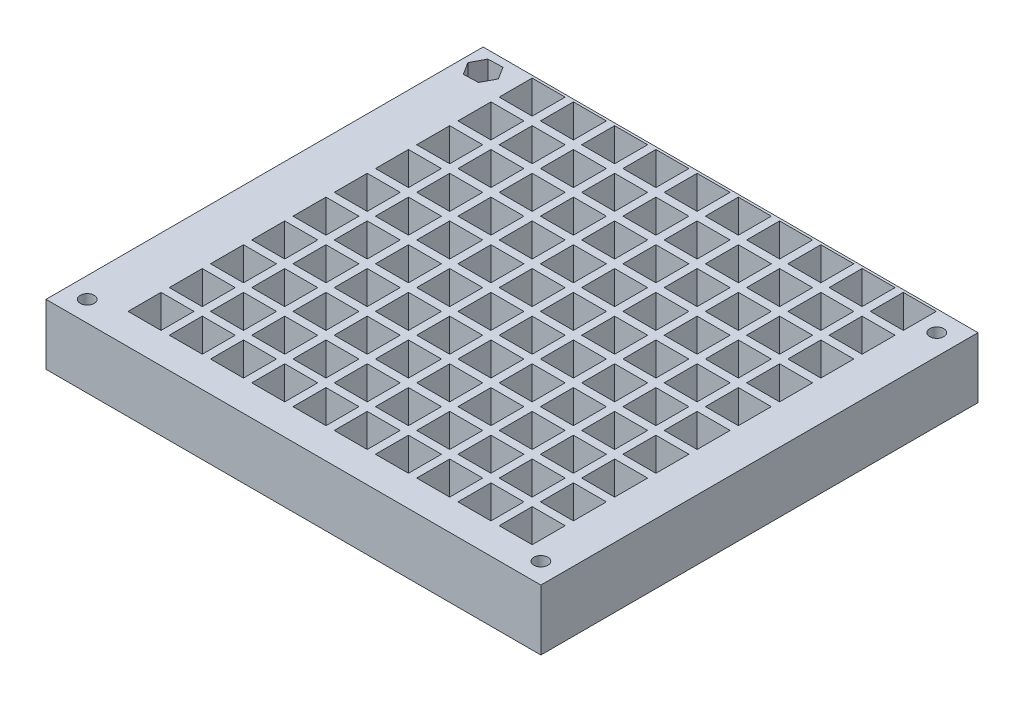
from build123d import *

# Parameters (mm, degrees)
SKETCH1_W           = 120
SKETCH1_H           = 106
SKETCH1_R           = 1.7
SKETCH1_W_2         = 8
SKETCH1_H_2         = 8
BOSS_EXTRUDE1_DEPTH = 14.7


with BuildPart() as part:
    # Sketch1 → Boss-Extrude1 (new body)
    with BuildSketch(Plane(origin=(0, 0, 0), x_dir=(1, 0, 0), z_dir=(0, 1, 0))):
        with Locations((60, 53)):
            Rectangle(SKETCH1_W, SKETCH1_H)
        with Locations((5, 5)):
            Circle(SKETCH1_R, mode=Mode.SUBTRACT)
        with Locations((16.476368188, 11.413812803)):
            Rectangle(SKETCH1_W_2, SKETCH1_H_2, mode=Mode.SUBTRACT)
        with Locations((26.476368188, 11.413812803)):
            Rectangle(SKETCH1_W_2, SKETCH1_H_2, mode=Mode.SUBTRACT)
        with Locations((16.476368188, 21.413812803)):
            Rectangle(SKETCH1_W_2, SKETCH1_H_2, mode=Mode.SUBTRACT)
        with Locations((26.476368188, 21.413812803)):
            Rectangle(SKETCH1_W_2, SKETCH1_H_2, mode=Mode.SUBTRACT)
        with Locations((36.476368188, 11.413812803)):
            Rectangle(SKETCH1_W_2, SKETCH1_H_2, mode=Mode.SUBTRACT)
        with Locations((46.476368188, 11.413812803)):
            Rectangle(SKETCH1_W_2, SKETCH1_H_2, mode=Mode.SUBTRACT)
        with Locations((56.476368188, 11.413812803)):
            Rectangle(SKETCH1_W_2, SKETCH1_H_2, mode=Mode.SUBTRACT)
        with Locations((36.476368188, 21.413812803)):
            Rectangle(SKETCH1_W_2, SKETCH1_H_2, mode=Mode.SUBTRACT)
        with Locations((46.476368188, 21.413812803)):
            Rectangle(SKETCH1_W_2, SKETCH1_H_2, mode=Mode.SUBTRACT)
        with Locations((56.476368188, 21.413812803)):
            Rectangle(SKETCH1_W_2, SKETCH1_H_2, mode=Mode.SUBTRACT)
        with Locations((16.476368188, 31.413812803)):
            Rectangle(SKETCH1_W_2, SKETCH1_H_2, mode=Mode.SUBTRACT)
        with Locations((26.476368188, 31.413812803)):
            Rectangle(SKETCH1_W_2, SKETCH1_H_2, mode=Mode.SUBTRACT)
        with Locations((16.476368188, 41.413812803)):
            Rectangle(SKETCH1_W_2, SKETCH1_H_2, mode=Mode.SUBTRACT)
        with Locations((26.476368188, 41.413812803)):
            Rectangle(SKETCH1_W_2, SKETCH1_H_2, mode=Mode.SUBTRACT)
        with Locations((16.476368188, 51.413812803)):
            Rectangle(SKETCH1_W_2, SKETCH1_H_2, mode=Mode.SUBTRACT)
        with Locations((26.476368188, 51.413812803)):
            Rectangle(SKETCH1_W_2, SKETCH1_H_2, mode=Mode.SUBTRACT)
        with Locations((36.476368188, 31.413812803)):
            Rectangle(SKETCH1_W_2, SKETCH1_H_2, mode=Mode.SUBTRACT)
        with Locations((46.476368188, 31.413812803)):
            Rectangle(SKETCH1_W_2, SKETCH1_H_2, mode=Mode.SUBTRACT)
        with Locations((56.476368188, 31.413812803)):
            Rectangle(SKETCH1_W_2, SKETCH1_H_2, mode=Mode.SUBTRACT)
        with Locations((36.476368188, 41.413812803)):
            Rectangle(SKETCH1_W_2, SKETCH1_H_2, mode=Mode.SUBTRACT)
        with Locations((36.476368188, 51.413812803)):
            Rectangle(SKETCH1_W_2, SKETCH1_H_2, mode=Mode.SUBTRACT)
        with Locations((46.476368188, 41.413812803)):
            Rectangle(SKETCH1_W_2, SKETCH1_H_2, mode=Mode.SUBTRACT)
        with Locations((56.476368188, 41.413812803)):
            Rectangle(SKETCH1_W_2, SKETCH1_H_2, mode=Mode.SUBTRACT)
        with Locations((46.476368188, 51.413812803)):
            Rectangle(SKETCH1_W_2, SKETCH1_H_2, mode=Mode.SUBTRACT)
        with Locations((56.476368188, 51.413812803)):
            Rectangle(SKETCH1_W_2, SKETCH1_H_2, mode=Mode.SUBTRACT)
        with Locations((66.476368188, 11.413812803)):
            Rectangle(SKETCH1_W_2, SKETCH1_H_2, mode=Mode.SUBTRACT)
        with Locations((76.476368188, 11.413812803)):
            Rectangle(SKETCH1_W_2, SKETCH1_H_2, mode=Mode.SUBTRACT)
        with Locations((86.476368188, 11.413812803)):
            Rectangle(SKETCH1_W_2, SKETCH1_H_2, mode=Mode.SUBTRACT)
        with Locations((66.476368188, 21.413812803)):
            Rectangle(SKETCH1_W_2, SKETCH1_H_2, mode=Mode.SUBTRACT)
        with Locations((76.476368188, 21.413812803)):
            Rectangle(SKETCH1_W_2, SKETCH1_H_2, mode=Mode.SUBTRACT)
        with Locations((86.476368188, 21.413812803)):
            Rectangle(SKETCH1_W_2, SKETCH1_H_2, mode=Mode.SUBTRACT)
        with Locations((96.476368188, 11.413812803)):
            Rectangle(SKETCH1_W_2, SKETCH1_H_2, mode=Mode.SUBTRACT)
        with Locations((115, 5)):
            Circle(SKETCH1_R, mode=Mode.SUBTRACT)
        with Locations((106.476368188, 11.413812803)):
            Rectangle(SKETCH1_W_2, SKETCH1_H_2, mode=Mode.SUBTRACT)
        with Locations((96.476368188, 21.413812803)):
            Rectangle(SKETCH1_W_2, SKETCH1_H_2, mode=Mode.SUBTRACT)
        with Locations((106.476368188, 21.413812803)):
            Rectangle(SKETCH1_W_2, SKETCH1_H_2, mode=Mode.SUBTRACT)
        with Locations((66.476368188, 31.413812803)):
            Rectangle(SKETCH1_W_2, SKETCH1_H_2, mode=Mode.SUBTRACT)
        with Locations((76.476368188, 31.413812803)):
            Rectangle(SKETCH1_W_2, SKETCH1_H_2, mode=Mode.SUBTRACT)
        with Locations((86.476368188, 31.413812803)):
            Rectangle(SKETCH1_W_2, SKETCH1_H_2, mode=Mode.SUBTRACT)
        with Locations((66.476368188, 41.413812803)):
            Rectangle(SKETCH1_W_2, SKETCH1_H_2, mode=Mode.SUBTRACT)
        with Locations((66.476368188, 51.413812803)):
            Rectangle(SKETCH1_W_2, SKETCH1_H_2, mode=Mode.SUBTRACT)
        with Locations((76.476368188, 41.413812803)):
            Rectangle(SKETCH1_W_2, SKETCH1_H_2, mode=Mode.SUBTRACT)
        with Locations((86.476368188, 41.413812803)):
            Rectangle(SKETCH1_W_2, SKETCH1_H_2, mode=Mode.SUBTRACT)
        with Locations((76.476368188, 51.413812803)):
            Rectangle(SKETCH1_W_2, SKETCH1_H_2, mode=Mode.SUBTRACT)
        with Locations((86.476368188, 51.413812803)):
            Rectangle(SKETCH1_W_2, SKETCH1_H_2, mode=Mode.SUBTRACT)
        with Locations((96.476368188, 31.413812803)):
            Rectangle(SKETCH1_W_2, SKETCH1_H_2, mode=Mode.SUBTRACT)
        with Locations((106.476368188, 31.413812803)):
            Rectangle(SKETCH1_W_2, SKETCH1_H_2, mode=Mode.SUBTRACT)
        with Locations((96.476368188, 41.413812803)):
            Rectangle(SKETCH1_W_2, SKETCH1_H_2, mode=Mode.SUBTRACT)
        with Locations((96.476368188, 51.413812803)):
            Rectangle(SKETCH1_W_2, SKETCH1_H_2, mode=Mode.SUBTRACT)
        with Locations((106.476368188, 41.413812803)):
            Rectangle(SKETCH1_W_2, SKETCH1_H_2, mode=Mode.SUBTRACT)
        with Locations((106.476368188, 51.413812803)):
            Rectangle(SKETCH1_W_2, SKETCH1_H_2, mode=Mode.SUBTRACT)
        with Locations((16.476368188, 61.413812803)):
            Rectangle(SKETCH1_W_2, SKETCH1_H_2, mode=Mode.SUBTRACT)
        with Locations((26.476368188, 61.413812803)):
            Rectangle(SKETCH1_W_2, SKETCH1_H_2, mode=Mode.SUBTRACT)
        with Locations((16.476368188, 71.413812803)):
            Rectangle(SKETCH1_W_2, SKETCH1_H_2, mode=Mode.SUBTRACT)
        with Locations((26.476368188, 71.413812803)):
            Rectangle(SKETCH1_W_2, SKETCH1_H_2, mode=Mode.SUBTRACT)
        with Locations((36.476368188, 61.413812803)):
            Rectangle(SKETCH1_W_2, SKETCH1_H_2, mode=Mode.SUBTRACT)
        with Locations((46.476368188, 61.413812803)):
            Rectangle(SKETCH1_W_2, SKETCH1_H_2, mode=Mode.SUBTRACT)
        with Locations((56.476368188, 61.413812803)):
            Rectangle(SKETCH1_W_2, SKETCH1_H_2, mode=Mode.SUBTRACT)
        with Locations((36.476368188, 71.413812803)):
            Rectangle(SKETCH1_W_2, SKETCH1_H_2, mode=Mode.SUBTRACT)
        with Locations((46.476368188, 71.413812803)):
            Rectangle(SKETCH1_W_2, SKETCH1_H_2, mode=Mode.SUBTRACT)
        with Locations((56.476368188, 71.413812803)):
            Rectangle(SKETCH1_W_2, SKETCH1_H_2, mode=Mode.SUBTRACT)
        with Locations((16.476368188, 81.413812803)):
            Rectangle(SKETCH1_W_2, SKETCH1_H_2, mode=Mode.SUBTRACT)
        with Locations((26.476368188, 81.413812803)):
            Rectangle(SKETCH1_W_2, SKETCH1_H_2, mode=Mode.SUBTRACT)
        with Locations((16.476368188, 91.413812803)):
            Rectangle(SKETCH1_W_2, SKETCH1_H_2, mode=Mode.SUBTRACT)
        with Locations((26.476368188, 91.413812803)):
            Rectangle(SKETCH1_W_2, SKETCH1_H_2, mode=Mode.SUBTRACT)
        Polygon((8.563998522, 101.126779154), (6.891793229, 97.976876318), (3.327794707, 97.850097164), (1.436001478, 100.873220846), (3.108206771, 104.023123682), (6.672205293, 104.149902836), align=None, mode=Mode.SUBTRACT)
        with Locations((16.476368188, 101.413812803)):
            Rectangle(SKETCH1_W_2, SKETCH1_H_2, mode=Mode.SUBTRACT)
        with Locations((26.476368188, 101.413812803)):
            Rectangle(SKETCH1_W_2, SKETCH1_H_2, mode=Mode.SUBTRACT)
        with Locations((36.476368188, 81.413812803)):
            Rectangle(SKETCH1_W_2, SKETCH1_H_2, mode=Mode.SUBTRACT)
        with Locations((36.476368188, 91.413812803)):
            Rectangle(SKETCH1_W_2, SKETCH1_H_2, mode=Mode.SUBTRACT)
        with Locations((46.476368188, 81.413812803)):
            Rectangle(SKETCH1_W_2, SKETCH1_H_2, mode=Mode.SUBTRACT)
        with Locations((56.476368188, 81.413812803)):
            Rectangle(SKETCH1_W_2, SKETCH1_H_2, mode=Mode.SUBTRACT)
        with Locations((46.476368188, 91.413812803)):
            Rectangle(SKETCH1_W_2, SKETCH1_H_2, mode=Mode.SUBTRACT)
        with Locations((56.476368188, 91.413812803)):
            Rectangle(SKETCH1_W_2, SKETCH1_H_2, mode=Mode.SUBTRACT)
        with Locations((36.476368188, 101.413812803)):
            Rectangle(SKETCH1_W_2, SKETCH1_H_2, mode=Mode.SUBTRACT)
        with Locations((46.476368188, 101.413812803)):
            Rectangle(SKETCH1_W_2, SKETCH1_H_2, mode=Mode.SUBTRACT)
        with Locations((56.476368188, 101.413812803)):
            Rectangle(SKETCH1_W_2, SKETCH1_H_2, mode=Mode.SUBTRACT)
        with Locations((66.476368188, 61.413812803)):
            Rectangle(SKETCH1_W_2, SKETCH1_H_2, mode=Mode.SUBTRACT)
        with Locations((76.476368188, 61.413812803)):
            Rectangle(SKETCH1_W_2, SKETCH1_H_2, mode=Mode.SUBTRACT)
        with Locations((86.476368188, 61.413812803)):
            Rectangle(SKETCH1_W_2, SKETCH1_H_2, mode=Mode.SUBTRACT)
        with Locations((66.476368188, 71.413812803)):
            Rectangle(SKETCH1_W_2, SKETCH1_H_2, mode=Mode.SUBTRACT)
        with Locations((76.476368188, 71.413812803)):
            Rectangle(SKETCH1_W_2, SKETCH1_H_2, mode=Mode.SUBTRACT)
        with Locations((86.476368188, 71.413812803)):
            Rectangle(SKETCH1_W_2, SKETCH1_H_2, mode=Mode.SUBTRACT)
        with Locations((96.476368188, 61.413812803)):
            Rectangle(SKETCH1_W_2, SKETCH1_H_2, mode=Mode.SUBTRACT)
        with Locations((106.476368188, 61.413812803)):
            Rectangle(SKETCH1_W_2, SKETCH1_H_2, mode=Mode.SUBTRACT)
        with Locations((96.476368188, 71.413812803)):
            Rectangle(SKETCH1_W_2, SKETCH1_H_2, mode=Mode.SUBTRACT)
        with Locations((106.476368188, 71.413812803)):
            Rectangle(SKETCH1_W_2, SKETCH1_H_2, mode=Mode.SUBTRACT)
        with Locations((66.476368188, 81.413812803)):
            Rectangle(SKETCH1_W_2, SKETCH1_H_2, mode=Mode.SUBTRACT)
        with Locations((66.476368188, 91.413812803)):
            Rectangle(SKETCH1_W_2, SKETCH1_H_2, mode=Mode.SUBTRACT)
        with Locations((76.476368188, 81.413812803)):
            Rectangle(SKETCH1_W_2, SKETCH1_H_2, mode=Mode.SUBTRACT)
        with Locations((86.476368188, 81.413812803)):
            Rectangle(SKETCH1_W_2, SKETCH1_H_2, mode=Mode.SUBTRACT)
        with Locations((76.476368188, 91.413812803)):
            Rectangle(SKETCH1_W_2, SKETCH1_H_2, mode=Mode.SUBTRACT)
        with Locations((86.476368188, 91.413812803)):
            Rectangle(SKETCH1_W_2, SKETCH1_H_2, mode=Mode.SUBTRACT)
        with Locations((66.476368188, 101.413812803)):
            Rectangle(SKETCH1_W_2, SKETCH1_H_2, mode=Mode.SUBTRACT)
        with Locations((76.476368188, 101.413812803)):
            Rectangle(SKETCH1_W_2, SKETCH1_H_2, mode=Mode.SUBTRACT)
        with Locations((86.476368188, 101.413812803)):
            Rectangle(SKETCH1_W_2, SKETCH1_H_2, mode=Mode.SUBTRACT)
        with Locations((96.476368188, 81.413812803)):
            Rectangle(SKETCH1_W_2, SKETCH1_H_2, mode=Mode.SUBTRACT)
        with Locations((96.476368188, 91.413812803)):
            Rectangle(SKETCH1_W_2, SKETCH1_H_2, mode=Mode.SUBTRACT)
        with Locations((106.476368188, 81.413812803)):
            Rectangle(SKETCH1_W_2, SKETCH1_H_2, mode=Mode.SUBTRACT)
        with Locations((106.476368188, 91.413812803)):
            Rectangle(SKETCH1_W_2, SKETCH1_H_2, mode=Mode.SUBTRACT)
        with Locations((96.476368188, 101.413812803)):
            Rectangle(SKETCH1_W_2, SKETCH1_H_2, mode=Mode.SUBTRACT)
        with Locations((106.476368188, 101.413812803)):
            Rectangle(SKETCH1_W_2, SKETCH1_H_2, mode=Mode.SUBTRACT)
        with Locations((115, 101)):
            Circle(SKETCH1_R, mode=Mode.SUBTRACT)
    extrude(amount=BOSS_EXTRUDE1_DEPTH)


solid = part.part
